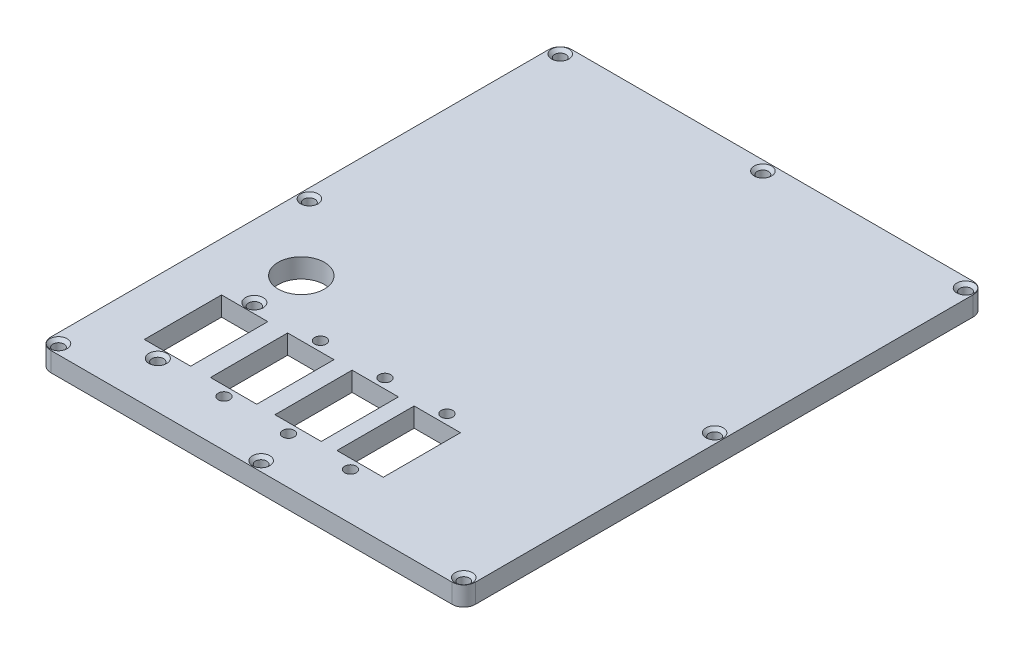
from build123d import *

# Parameters (mm, degrees)
SKETCH1_W           = 110
SKETCH1_H           = 135
SKETCH1_W_2         = 100
SKETCH1_H_2         = 125
BOSS_EXTRUDE1_DEPTH = 140
SKETCH2_W           = 110
SKETCH2_H           = 135
BOSS_EXTRUDE2_DEPTH = 5
SKETCH3_R           = 1.45
CUT_EXTRUDE1_DEPTH  = 12
SKETCH4_W           = 110
SKETCH4_H           = 135
CUT_EXTRUDE2_DEPTH  = 140
SKETCH6_W           = 100
SKETCH6_H           = 125
BOSS_EXTRUDE3_DEPTH = 5
FILLET1_R           = 3
SKETCH7_W           = 100
SKETCH7_H           = 125
SKETCH7_W_2         = 98
SKETCH7_H_2         = 123
CUT_EXTRUDE3_DEPTH  = 1
FILLET2_R           = 1
SKETCH8_W           = 12
SKETCH8_H           = 20
SKETCH8_R           = 1.5
CUT_EXTRUDE4_DEPTH  = 12
SKETCH9_R           = 6
CUT_EXTRUDE5_DEPTH  = 10
CHAMFER1_SIZE       = 0.8


with BuildPart() as part:
    # Sketch1 → Boss-Extrude1 (new body)
    with BuildSketch(Plane(origin=(0, 0, 0), x_dir=(1, 0, 0), z_dir=(0, 1, 0))):
        Rectangle(SKETCH1_W, SKETCH1_H)
        Rectangle(SKETCH1_W_2, SKETCH1_H_2, mode=Mode.SUBTRACT)
    extrude(amount=BOSS_EXTRUDE1_DEPTH)

    # Sketch2 → Boss-Extrude2 (add)
    with BuildSketch(Plane(origin=(0, 140, 0), x_dir=(1, 0, 0), z_dir=(0, 1, 0))):
        Rectangle(SKETCH2_W, SKETCH2_H)
    extrude(amount=BOSS_EXTRUDE2_DEPTH)

    # Sketch3 → Cut-Extrude1 (cut)
    with BuildSketch(Plane.XZ):
        with Locations((-52.5, 65)):
            Circle(SKETCH3_R)
        with Locations((0, 65)):
            Circle(SKETCH3_R)
        with Locations((-52.5, 0)):
            Circle(SKETCH3_R)
        with Locations((52.5, 65)):
            Circle(SKETCH3_R)
        with Locations((-52.5, -65)):
            Circle(SKETCH3_R)
        with Locations((52.5, 0)):
            Circle(SKETCH3_R)
        with Locations((0, -65)):
            Circle(SKETCH3_R)
        with Locations((52.5, -65)):
            Circle(SKETCH3_R)
    extrude(amount=-CUT_EXTRUDE1_DEPTH, mode=Mode.SUBTRACT)

    # Sketch4 → Cut-Extrude2 (cut)
    with BuildSketch(Plane(origin=(0, 145, 0), x_dir=(1, 0, 0), z_dir=(0, 1, 0))):
        Rectangle(SKETCH4_W, SKETCH4_H)
    extrude(amount=-CUT_EXTRUDE2_DEPTH, mode=Mode.SUBTRACT)

    # Sketch6 → Boss-Extrude3 (add)
    with BuildSketch(Plane.XZ):
        Rectangle(SKETCH6_W, SKETCH6_H)
    extrude(amount=-BOSS_EXTRUDE3_DEPTH)

    # Fillet1
    fillet1_edges = [part.edges().sort_by_distance(p)[0] for p in [
        (-55, 2.5, 67.5),
        (-55, 2.5, -67.5),
        (55, 2.5, -67.5),
        (55, 2.5, 67.5),
    ]]
    fillet(fillet1_edges, radius=FILLET1_R)

    # Sketch7 → Cut-Extrude3 (cut)
    with BuildSketch(Plane.XZ):
        Rectangle(SKETCH7_W, SKETCH7_H)
        Rectangle(SKETCH7_W_2, SKETCH7_H_2, mode=Mode.SUBTRACT)
    extrude(amount=-CUT_EXTRUDE3_DEPTH, mode=Mode.SUBTRACT)

    # Fillet2
    fillet2_edges = [part.edges().sort_by_distance(p)[0] for p in [
        (-50, 0.5, 62.5),
        (-49, 0.5, 61.5),
        (-49, 0.5, -61.5),
        (-50, 0.5, -62.5),
        (50, 0.5, -62.5),
        (49, 0.5, -61.5),
        (50, 0.5, 62.5),
        (49, 0.5, 61.5),
    ]]
    fillet(fillet2_edges, radius=FILLET2_R)

    # Sketch8 → Cut-Extrude4 (cut)
    with BuildSketch(Plane.XZ):
        with Locations((-2.530494279, 42.89187803)):
            Rectangle(SKETCH8_W, SKETCH8_H)
        with Locations((-19.231756521, 42.89187803)):
            Rectangle(SKETCH8_W, SKETCH8_H)
        with Locations((-36.337425876, 42.923519988)):
            Rectangle(SKETCH8_W, SKETCH8_H)
        with Locations((13.538144393, 42.89187803)):
            Rectangle(SKETCH8_W, SKETCH8_H)
        with Locations((-36.337425876, 55.423519988)):
            Circle(SKETCH8_R)
        with Locations((-36.337425876, 30.423519988)):
            Circle(SKETCH8_R)
        with Locations((-19.231756521, 55.39187803)):
            Circle(SKETCH8_R)
        with Locations((-19.231756521, 30.39187803)):
            Circle(SKETCH8_R)
        with Locations((-2.530494279, 55.39187803)):
            Circle(SKETCH8_R)
        with Locations((-2.530494279, 30.39187803)):
            Circle(SKETCH8_R)
        with Locations((13.538144393, 55.39187803)):
            Circle(SKETCH8_R)
        with Locations((13.538144393, 30.39187803)):
            Circle(SKETCH8_R)
    extrude(amount=-CUT_EXTRUDE4_DEPTH, mode=Mode.SUBTRACT)

    # Sketch9 → Cut-Extrude5 (cut)
    with BuildSketch(Plane.XZ):
        with Locations((-36.310720447, 18.284017074)):
            Circle(SKETCH9_R)
    extrude(amount=-CUT_EXTRUDE5_DEPTH, mode=Mode.SUBTRACT)

    # Chamfer1
    chamfer1_edges = [part.edges().sort_by_distance(p)[0] for p in [
        (-37.837425876, 5, 30.423519988),
        (-37.837425876, 5, 55.423519988),
        (-53.95, 5, -65),
        (-1.45, 5, -65),
        (51.05, 5, -65),
        (51.05, 5, 0),
        (51.05, 5, 65),
        (-1.45, 5, 65),
        (-53.95, 5, 65),
        (-53.95, 5, 0),
    ]]
    chamfer(chamfer1_edges, length=CHAMFER1_SIZE)


solid = part.part
